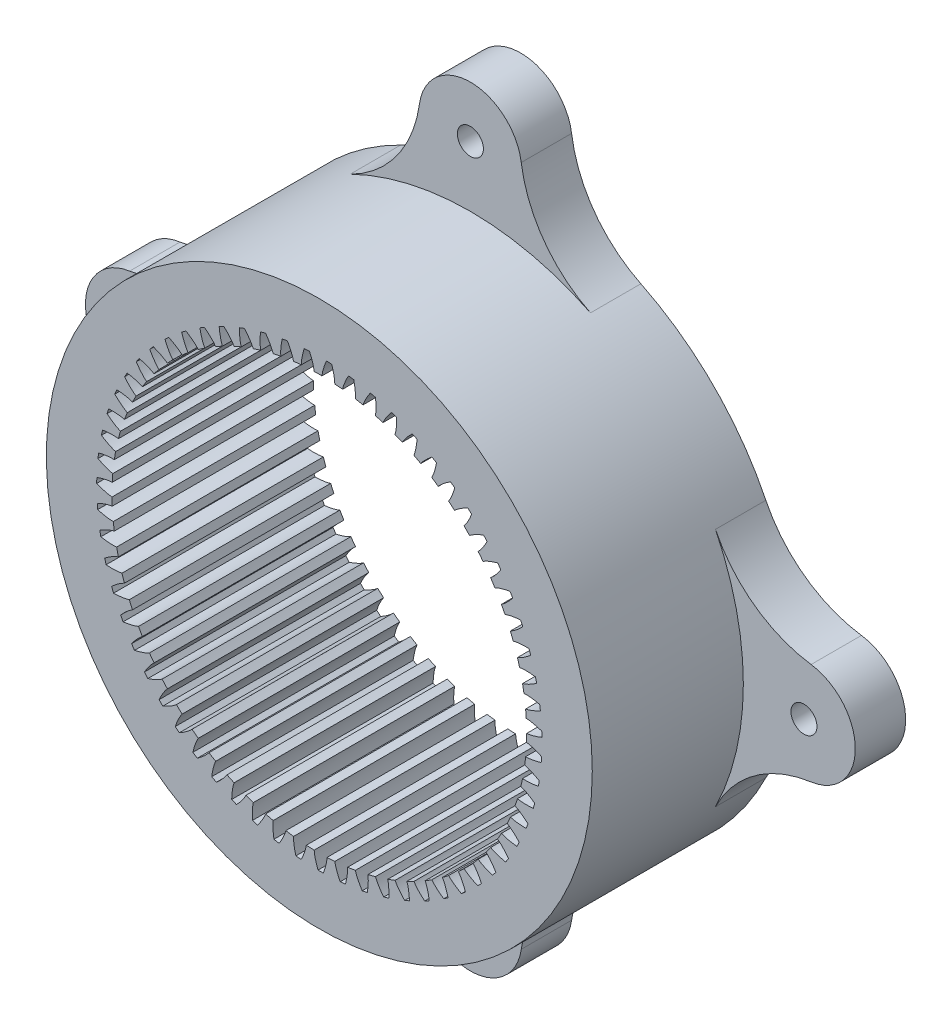
from build123d import *

# Parameters (mm, degrees)
SKETCH1_R                = 32.5275
BOSS_EXTRUDE1_DEPTH      = 24
SKETCH5_R                = 24.705
CUT_EXTRUDE1_DEPTH       = 52.885224414
CUT_EXTRUDE2_DEPTH       = 52.885224414
CIRPATTERN2_COUNT        = 63
SKETCH7_R                = 1.55
BOSS_EXTRUDE3_DEPTH      = 6
FILLET1_R                = 15
CIRPATTERN5_COUNT        = 4
FILLET1_OF_CIRPATTERN5_R = 15


with BuildPart() as part:
    # Sketch1 → Boss-Extrude1 (new body)
    with BuildSketch(Plane.XY):
        Circle(SKETCH1_R)
    extrude(amount=BOSS_EXTRUDE1_DEPTH)

    # Sketch5 → Cut-Extrude1 (cut, through all)
    with BuildSketch(Plane.XY.offset(24)):
        Circle(SKETCH5_R)
    extrude(amount=-CUT_EXTRUDE1_DEPTH, mode=Mode.SUBTRACT)

    # Sketch6 → Cut-Extrude2 (cut, symmetric)
    with BuildSketch(Plane.XY.offset(24)):
        with BuildLine():
            add(Edge.make_bspline(
                [(24.704999848, 0.002742008), (24.708343794, 0.002969169), (24.744496405, 0.005527663), (24.825943117, 0.013680663), (24.967742151, 0.033040916), (25.165973865, 0.070017802), (25.420327986, 0.12896254), (25.717083381, 0.212581536), (26.030958622, 0.316399656), (26.282283518, 0.411542249), (26.44556453, 0.478055806), (26.522588324, 0.510455551)],
                knots=[0.004387589, 0.004387589, 0.004387589, 0.004387589, 0.004387589, 0.005376748, 0.015083688, 0.02853182, 0.046610139, 0.064854849, 0.092110525, 0.119476175, 0.144134326, 0.144134326, 0.144134326, 0.144134326, 0.144134326], degree=4))
            ThreePointArc((26.522588324, 0.510455551), (26.514686156, 0.824423627), (26.503067439, 1.138276143))
            add(Edge.make_bspline(
                [(24.657447712, 1.53208921), (24.660799311, 1.532070234), (24.697041036, 1.531762704), (24.778836931, 1.528685422), (24.921564831, 1.518171992), (25.121710852, 1.493581902), (25.379235648, 1.450553063), (25.680612727, 1.385531856), (26.000331474, 1.301414134), (26.257081728, 1.222069169), (26.424179561, 1.165828113), (26.503067439, 1.138276143)],
                knots=[0.004387589, 0.004387589, 0.004387589, 0.004387589, 0.004387589, 0.005376748, 0.015083688, 0.02853182, 0.046610139, 0.064854849, 0.092110525, 0.119476175, 0.144134326, 0.144134326, 0.144134326, 0.144134326, 0.144134326], degree=4))
            ThreePointArc((24.657447712, 1.53208921), (24.693066496, 0.767783836), (24.704999848, 0.002742008))
        make_face()
    cut_extrude2 = extrude(amount=CUT_EXTRUDE2_DEPTH, both=True, mode=Mode.SUBTRACT)

    # CirPattern2: Cut-Extrude2 ×63 about axis
    cirpattern2_axis = Axis((0, 0, 24), (0, 0, -1))
    for i in range(1, CIRPATTERN2_COUNT):
        add(cut_extrude2.rotate(cirpattern2_axis, i * 360 / CIRPATTERN2_COUNT), mode=Mode.SUBTRACT)

    # Sketch7 → Boss-Extrude3 (add)
    with BuildSketch(Plane.XY):
        with BuildLine():
            Line((-39.75, 6.120135742), (-31.946552157, 6.120135742))
            ThreePointArc((-31.946552157, 6.120135742), (-32.5275, 0), (-31.946552157, -6.120135742))
            Line((-31.946552157, -6.120135742), (-39.75, -6.120135742))
            ThreePointArc((-39.75, -6.120135742), (-45.870135742, 0), (-39.75, 6.120135742))
        make_face()
        with Locations((-39.75, 0)):
            Circle(SKETCH7_R, mode=Mode.SUBTRACT)
    boss_extrude3 = extrude(amount=BOSS_EXTRUDE3_DEPTH)

    # Fillet1
    # the kernel refuses this fillet: 15 mm, written as the material it adds along each edge
    with BuildSketch(Plane(origin=(-31.946552157, 6.120135742, 0), x_dir=(0.3169276667007993, 0.948449710885921, 0), z_dir=(0, 0, 1))) as fillet1_piece_1:
        with BuildLine():
            CenterArc((10.632419537, 14.867114825), FILLET1_R, 206.444900199, 55.922870544)
            Line((-2.798026124, 8.187060234), (-4.14107069, 7.519054775))
            ThreePointArc((-4.14107069, 7.519054775), (-3.895803083, 6.92578635), (-1.422674566, -0.4753915))
            Line((-1.422674566, -0.4753915), (0.199220902, -1.486711483))
            ThreePointArc((0.199220902, -1.486711483), (4.320105259, -1.211838498), (8.440989616, -1.486711483))
            Line((8.440989616, -1.486711483), (8.640210518, 0))
        make_face()
    extrude(amount=6)
    with BuildSketch(Plane(origin=(-31.946552157, -6.120135742, 0), x_dir=(0.3169276667007999, -0.9484497108859208, 0), z_dir=(0, 0, 1))) as fillet1_piece_2:
        with BuildLine():
            CenterArc((10.632419537, -14.867114825), FILLET1_R, 97.632229257, 55.922870544)
            Line((-2.798026124, -8.187060234), (-4.14107069, -7.519054775))
            ThreePointArc((-4.14107069, -7.519054775), (-3.895803083, -6.92578635), (-1.422674566, 0.4753915))
            Line((-1.422674566, 0.4753915), (0.199220902, 1.486711483))
            ThreePointArc((0.199220902, 1.486711483), (4.320105259, 1.211838498), (8.440989616, 1.486711483))
            Line((8.440989616, 1.486711483), (8.640210518, 0))
        make_face()
    extrude(amount=6)

    # CirPattern5: Boss-Extrude3 ×4 about axis
    cirpattern5_axis = Axis((0, 0, 0), (0, 0, 1))
    for i in range(1, CIRPATTERN5_COUNT):
        add(boss_extrude3.rotate(cirpattern5_axis, i * 360 / CIRPATTERN5_COUNT))

    # Fillet1 of CirPattern5
    # the kernel refuses this fillet: 15 mm, written as the material it adds along each edge
    with BuildSketch(Plane(origin=(-6.120135742, -31.946552157, 0), x_dir=(-0.9484497108859242, 0.31692766670078903, 0), z_dir=(0, 0, 1)), Plane(origin=(31.946552157, -6.120135742, 0), x_dir=(-0.31692766670079386, -0.9484497108859228, 0), z_dir=(0, 0, 1)), Plane(origin=(6.120135742, 31.946552157, 0), x_dir=(0.9484497108859192, -0.31692766670080436, 0), z_dir=(0, 0, 1))) as fillet1_of_cirpattern5_piece_1:
        with BuildLine():
            CenterArc((10.632419537, 14.867114825), FILLET1_OF_CIRPATTERN5_R, 206.444900199, 55.922870544)
            Line((-2.798026124, 8.187060234), (-4.14107069, 7.519054775))
            ThreePointArc((-4.14107069, 7.519054775), (-3.895803083, 6.92578635), (-1.422674566, -0.4753915))
            Line((-1.422674566, -0.4753915), (0.199220902, -1.486711483))
            ThreePointArc((0.199220902, -1.486711483), (4.320105259, -1.211838498), (8.440989616, -1.486711483))
            Line((8.440989616, -1.486711483), (8.640210518, 0))
        make_face()
    extrude(amount=6)
    with BuildSketch(Plane(origin=(6.120135742, -31.946552157, 0), x_dir=(0.9484497108859224, 0.316927666700795, 0), z_dir=(0, 0, 1)), Plane(origin=(31.946552157, 6.120135742, 0), x_dir=(-0.31692766670080597, 0.9484497108859188, 0), z_dir=(0, 0, 1)), Plane(origin=(-6.120135742, 31.946552157, 0), x_dir=(-0.9484497108859173, -0.31692766670081035, 0), z_dir=(0, 0, 1))) as fillet1_of_cirpattern5_piece_2:
        with BuildLine():
            CenterArc((10.632419537, -14.867114825), FILLET1_OF_CIRPATTERN5_R, 97.632229257, 55.922870544)
            Line((-2.798026124, -8.187060234), (-4.14107069, -7.519054775))
            ThreePointArc((-4.14107069, -7.519054775), (-3.895803083, -6.92578635), (-1.422674566, 0.4753915))
            Line((-1.422674566, 0.4753915), (0.199220902, 1.486711483))
            ThreePointArc((0.199220902, 1.486711483), (4.320105259, 1.211838498), (8.440989616, 1.486711483))
            Line((8.440989616, 1.486711483), (8.640210518, 0))
        make_face()
    extrude(amount=6)


solid = part.part
